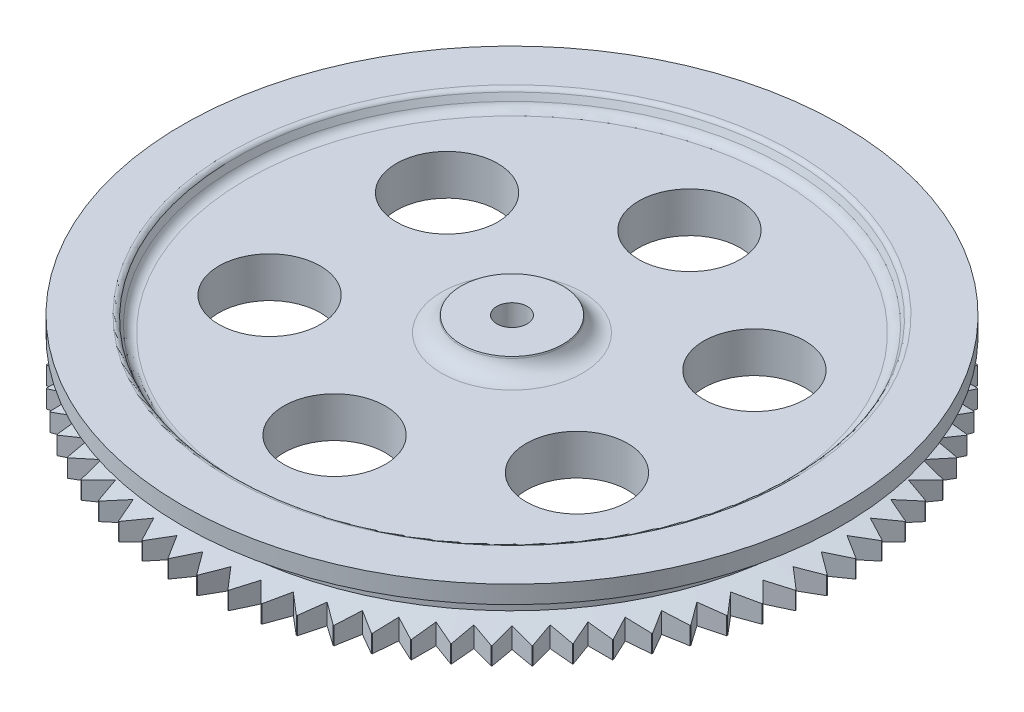
from build123d import *

# Parameters (mm, degrees)
SKETCH_2_R           = 3
CUT_EXTRUDE_1_DEPTH  = 93.983869569
CUT_EXTRUDE_2_DEPTH  = 5
CUT_EXTRUDE_6_DEPTH  = 5
CUT_EXTRUDE_7_DEPTH  = 5
CUT_EXTRUDE_8_DEPTH  = 5
CUT_EXTRUDE_9_DEPTH  = 5
CUT_EXTRUDE_10_DEPTH = 5
CUT_EXTRUDE_11_DEPTH = 5
SKETCH_5_R           = 10
CUT_EXTRUDE_12_DEPTH = 93.983869569
FILLET_1_R           = 2
FILLET_2_R           = 1
FILLET_3_R           = 4
FILLET_4_R           = 6
FILLET_5_R           = 3
FILLET_6_R           = 1


with BuildPart() as part:
    # Эскиз1 → Повернуть1 (revolve)
    with BuildSketch(Plane(origin=(0, 0, 0), x_dir=(0, 0, -1), z_dir=(1, 0, 0))):
        Polygon((0, 0), (0, 7), (-10, 7), (-11, 4), (-53.666009088, 4), (-55, 7), (-65, 7), (-65, 3.502957646), (-58, 2.5), (-58, 0), (-58, -2.5), (-65, -3.5), (-65, -7), (-55, -7), (-51.666666667, -4), (-20, -4), (-15, -7), (0, -7), align=None)
    revolve(axis=Axis((0, 0, 0), (0, -1, 0)))

    # Эскиз2 → Вырез-Вытянуть1 (cut, through all)
    with BuildSketch(Plane(origin=(0, 7, 0), x_dir=(1, 0, 0), z_dir=(0, 1, 0))):
        Circle(SKETCH_2_R)
    extrude(amount=-CUT_EXTRUDE_1_DEPTH, mode=Mode.SUBTRACT)

    # Эскиз3 → Вырез-Вытянуть2 (cut)
    with BuildSketch(Plane(origin=(0, -7, 0), x_dir=(-1, 0, 0), z_dir=(0, -1, 0))):
        Polygon((-6.5, 0), (-3.25, -5.629165125), (3.25, -5.629165125), (6.5, 0), (3.25, 5.629165125), (-3.25, 5.629165125), align=None)
    extrude(amount=-CUT_EXTRUDE_2_DEPTH, mode=Mode.SUBTRACT)

    # Эскиз4 → Вырез-Вытянуть6 (cut)
    with BuildSketch(Plane(origin=(0, -7, 0), x_dir=(-1, 0, 0), z_dir=(0, -1, 0))):
        with BuildLine():
            ThreePointArc((-13.994813839, -63.475547935), (-11.287131548, -64.012503946), (-8.559092709, -64.43401223))
            Line((-8.559092709, -64.43401223), (-10.592538838, -60.073272934))
            Line((-10.592538838, -60.073272934), (-13.994813839, -63.475547935))
        make_face()
        with BuildLine():
            Line((0, -61), (-2.759787945, -64.941385653))
            ThreePointArc((-2.759787945, -64.941385653), (0, -65), (2.759787945, -64.941385653))
            Line((2.759787945, -64.941385653), (0, -61))
        make_face()
        with BuildLine():
            ThreePointArc((-24.804614396, -60.081037813), (-22.231309316, -61.080020351), (-19.617909662, -61.96884395))
            Line((-19.617909662, -61.96884395), (-20.863228743, -57.321249868))
            Line((-20.863228743, -57.321249868), (-24.804614396, -60.081037813))
        make_face()
        with BuildLine():
            Line((10.592538838, -60.073272934), (8.559092709, -64.43401223))
            ThreePointArc((8.559092709, -64.43401223), (11.287131548, -64.012503946), (13.994813839, -63.475547935))
            Line((13.994813839, -63.475547935), (10.592538838, -60.073272934))
        make_face()
        with BuildLine():
            ThreePointArc((-34.860739296, -54.86099576), (-32.5, -56.291651246), (-30.080646357, -57.620783705))
            Line((-30.080646357, -57.620783705), (-30.5, -52.827549631))
            Line((-30.5, -52.827549631), (-34.860739296, -54.86099576))
        make_face()
        with BuildLine():
            Line((20.863228743, -57.321249868), (19.617909662, -61.96884395))
            ThreePointArc((19.617909662, -61.96884395), (22.231309316, -61.080020351), (24.804614396, -60.081037813))
            Line((24.804614396, -60.081037813), (20.863228743, -57.321249868))
        make_face()
        with BuildLine():
            ThreePointArc((-43.857638273, -47.974030111), (-41.78119463, -49.792888803), (-39.629397834, -51.521945104))
            Line((-39.629397834, -51.521945104), (-39.210044191, -46.72871103))
            Line((-39.210044191, -46.72871103), (-43.857638273, -47.974030111))
        make_face()
        with BuildLine():
            Line((30.5, -52.827549631), (30.080646357, -57.620783705))
            ThreePointArc((30.080646357, -57.620783705), (32.5, -56.291651246), (34.860739296, -54.86099576))
            Line((34.860739296, -54.86099576), (30.5, -52.827549631))
        make_face()
        with BuildLine():
            Line((39.210044191, -46.72871103), (39.629397834, -51.521945104))
            ThreePointArc((39.629397834, -51.521945104), (41.78119463, -49.792888803), (43.857638273, -47.974030111))
            Line((43.857638273, -47.974030111), (39.210044191, -46.72871103))
        make_face()
        with BuildLine():
            Line((46.72871103, -39.210044191), (47.974030111, -43.857638273))
            ThreePointArc((47.974030111, -43.857638273), (49.792888803, -41.78119463), (51.521945104, -39.629397834))
            Line((51.521945104, -39.629397834), (46.72871103, -39.210044191))
        make_face()
        with BuildLine():
            Line((52.827549631, -30.5), (54.86099576, -34.860739296))
            ThreePointArc((54.86099576, -34.860739296), (56.291651246, -32.5), (57.620783705, -30.080646357))
            Line((57.620783705, -30.080646357), (52.827549631, -30.5))
        make_face()
        with BuildLine():
            Line((57.321249868, -20.863228743), (60.081037813, -24.804614396))
            ThreePointArc((60.081037813, -24.804614396), (61.080020351, -22.231309316), (61.96884395, -19.617909662))
            Line((61.96884395, -19.617909662), (57.321249868, -20.863228743))
        make_face()
    extrude(amount=-CUT_EXTRUDE_6_DEPTH, mode=Mode.SUBTRACT)

    # Эскиз4<6> → Вырез-Вытянуть7 (cut)
    with BuildSketch(Plane(origin=(0, -7, 0), x_dir=(-1, 0, 0), z_dir=(0, -1, 0))):
        with BuildLine():
            Line((60.073272934, -10.592538838), (63.475547935, -13.994813839))
            ThreePointArc((63.475547935, -13.994813839), (64.012503946, -11.287131548), (64.43401223, -8.559092709))
            Line((64.43401223, -8.559092709), (60.073272934, -10.592538838))
        make_face()
        with BuildLine():
            Line((61, 0), (64.941385653, -2.759787945))
            ThreePointArc((64.941385653, -2.759787945), (65, 0), (64.941385653, 2.759787945))
            Line((64.941385653, 2.759787945), (61, 0))
        make_face()
        with BuildLine():
            Line((60.073272934, 10.592538838), (64.43401223, 8.559092709))
            ThreePointArc((64.43401223, 8.559092709), (64.012503946, 11.287131548), (63.475547935, 13.994813839))
            Line((63.475547935, 13.994813839), (60.073272934, 10.592538838))
        make_face()
        with BuildLine():
            Line((57.321249868, 20.863228743), (61.96884395, 19.617909662))
            ThreePointArc((61.96884395, 19.617909662), (61.080020351, 22.231309316), (60.081037813, 24.804614396))
            Line((60.081037813, 24.804614396), (57.321249868, 20.863228743))
        make_face()
        with BuildLine():
            Line((52.827549631, 30.5), (57.620783705, 30.080646357))
            ThreePointArc((57.620783705, 30.080646357), (56.291651246, 32.5), (54.86099576, 34.860739296))
            Line((54.86099576, 34.860739296), (52.827549631, 30.5))
        make_face()
        with BuildLine():
            Line((46.72871103, 39.210044191), (51.521945104, 39.629397834))
            ThreePointArc((51.521945104, 39.629397834), (49.792888803, 41.78119463), (47.974030111, 43.857638273))
            Line((47.974030111, 43.857638273), (46.72871103, 39.210044191))
        make_face()
        with BuildLine():
            Line((39.210044191, 46.72871103), (43.857638273, 47.974030111))
            ThreePointArc((43.857638273, 47.974030111), (41.78119463, 49.792888803), (39.629397834, 51.521945104))
            Line((39.629397834, 51.521945104), (39.210044191, 46.72871103))
        make_face()
        with BuildLine():
            Line((30.5, 52.827549631), (34.860739296, 54.86099576))
            ThreePointArc((34.860739296, 54.86099576), (32.5, 56.291651246), (30.080646357, 57.620783705))
            Line((30.080646357, 57.620783705), (30.5, 52.827549631))
        make_face()
        with BuildLine():
            ThreePointArc((-8.559092709, 64.43401223), (-11.287131548, 64.012503946), (-13.994813839, 63.475547935))
            Line((-13.994813839, 63.475547935), (-10.592538838, 60.073272934))
            Line((-10.592538838, 60.073272934), (-8.559092709, 64.43401223))
        make_face()
        with BuildLine():
            Line((20.863228743, 57.321249868), (24.804614396, 60.081037813))
            ThreePointArc((24.804614396, 60.081037813), (22.231309316, 61.080020351), (19.617909662, 61.96884395))
            Line((19.617909662, 61.96884395), (20.863228743, 57.321249868))
        make_face()
        with BuildLine():
            ThreePointArc((2.759787945, 64.941385653), (0, 65), (-2.759787945, 64.941385653))
            Line((-2.759787945, 64.941385653), (0, 61))
            Line((0, 61), (2.759787945, 64.941385653))
        make_face()
        with BuildLine():
            Line((10.592538838, 60.073272934), (13.994813839, 63.475547935))
            ThreePointArc((13.994813839, 63.475547935), (11.287131548, 64.012503946), (8.559092709, 64.43401223))
            Line((8.559092709, 64.43401223), (10.592538838, 60.073272934))
        make_face()
    extrude(amount=-CUT_EXTRUDE_7_DEPTH, mode=Mode.SUBTRACT)

    # Эскиз4<7> → Вырез-Вытянуть8 (cut)
    with BuildSketch(Plane(origin=(0, -7, 0), x_dir=(-1, 0, 0), z_dir=(0, -1, 0))):
        with BuildLine():
            ThreePointArc((-51.521945104, -39.629397834), (-49.792888803, -41.78119463), (-47.974030111, -43.857638273))
            Line((-47.974030111, -43.857638273), (-46.72871103, -39.210044191))
            Line((-46.72871103, -39.210044191), (-51.521945104, -39.629397834))
        make_face()
        with BuildLine():
            ThreePointArc((-57.620783705, -30.080646357), (-56.291651246, -32.5), (-54.86099576, -34.860739296))
            Line((-54.86099576, -34.860739296), (-52.827549631, -30.5))
            Line((-52.827549631, -30.5), (-57.620783705, -30.080646357))
        make_face()
        with BuildLine():
            ThreePointArc((-61.96884395, -19.617909662), (-61.080020351, -22.231309316), (-60.081037813, -24.804614396))
            Line((-60.081037813, -24.804614396), (-57.321249868, -20.863228743))
            Line((-57.321249868, -20.863228743), (-61.96884395, -19.617909662))
        make_face()
        with BuildLine():
            ThreePointArc((-64.43401223, -8.559092709), (-64.012503946, -11.287131548), (-63.475547935, -13.994813839))
            Line((-63.475547935, -13.994813839), (-60.073272934, -10.592538838))
            Line((-60.073272934, -10.592538838), (-64.43401223, -8.559092709))
        make_face()
        with BuildLine():
            ThreePointArc((-64.941385653, 2.759787945), (-65, 0), (-64.941385653, -2.759787945))
            Line((-64.941385653, -2.759787945), (-61, 0))
            Line((-61, 0), (-64.941385653, 2.759787945))
        make_face()
        with BuildLine():
            ThreePointArc((-63.475547935, 13.994813839), (-64.012503946, 11.287131548), (-64.43401223, 8.559092709))
            Line((-64.43401223, 8.559092709), (-60.073272934, 10.592538838))
            Line((-60.073272934, 10.592538838), (-63.475547935, 13.994813839))
        make_face()
        with BuildLine():
            ThreePointArc((-60.081037813, 24.804614396), (-61.080020351, 22.231309316), (-61.96884395, 19.617909662))
            Line((-61.96884395, 19.617909662), (-57.321249868, 20.863228743))
            Line((-57.321249868, 20.863228743), (-60.081037813, 24.804614396))
        make_face()
        with BuildLine():
            ThreePointArc((-54.86099576, 34.860739296), (-56.291651246, 32.5), (-57.620783705, 30.080646357))
            Line((-57.620783705, 30.080646357), (-52.827549631, 30.5))
            Line((-52.827549631, 30.5), (-54.86099576, 34.860739296))
        make_face()
        with BuildLine():
            ThreePointArc((-47.974030111, 43.857638273), (-49.792888803, 41.78119463), (-51.521945104, 39.629397834))
            Line((-51.521945104, 39.629397834), (-46.72871103, 39.210044191))
            Line((-46.72871103, 39.210044191), (-47.974030111, 43.857638273))
        make_face()
        with BuildLine():
            ThreePointArc((-39.629397834, 51.521945104), (-41.78119463, 49.792888803), (-43.857638273, 47.974030111))
            Line((-43.857638273, 47.974030111), (-39.210044191, 46.72871103))
            Line((-39.210044191, 46.72871103), (-39.629397834, 51.521945104))
        make_face()
        with BuildLine():
            ThreePointArc((-30.080646357, 57.620783705), (-32.5, 56.291651246), (-34.860739296, 54.86099576))
            Line((-34.860739296, 54.86099576), (-30.5, 52.827549631))
            Line((-30.5, 52.827549631), (-30.080646357, 57.620783705))
        make_face()
        with BuildLine():
            ThreePointArc((-19.617909662, 61.96884395), (-22.231309316, 61.080020351), (-24.804614396, 60.081037813))
            Line((-24.804614396, 60.081037813), (-20.863228743, 57.321249868))
            Line((-20.863228743, 57.321249868), (-19.617909662, 61.96884395))
        make_face()
    extrude(amount=-CUT_EXTRUDE_8_DEPTH, mode=Mode.SUBTRACT)

    # Эскиз4<8> → Вырез-Вытянуть9 (cut)
    with BuildSketch(Plane(origin=(0, -7, 0), x_dir=(-1, 0, 0), z_dir=(0, -1, 0))):
        with BuildLine():
            Line((-2.910728583, -64.934795442), (-5.316500308, -60.767876584))
            Line((-5.316500308, -60.767876584), (-8.40930082, -64.453732706))
            ThreePointArc((-8.40930082, -64.453732706), (-5.665123279, -64.752655376), (-2.910728583, -64.934795442))
        make_face()
        with BuildLine():
            Line((5.316500308, -60.767876584), (2.910728583, -64.934795442))
            ThreePointArc((2.910728583, -64.934795442), (5.665123279, -64.752655376), (8.40930082, -64.453732706))
            Line((8.40930082, -64.453732706), (5.316500308, -60.767876584))
        make_face()
        with BuildLine():
            Line((15.787961751, -58.921475404), (14.142316971, -63.442847278))
            ThreePointArc((14.142316971, -63.442847278), (16.823237932, -62.785178709), (19.473817873, -62.014275916))
            Line((19.473817873, -62.014275916), (15.787961751, -58.921475404))
        make_face()
        with BuildLine():
            Line((25.779713966, -55.284775009), (24.944198214, -60.023220302))
            ThreePointArc((24.944198214, -60.023220302), (27.470187013, -58.910006157), (29.946632825, -57.690546734))
            Line((29.946632825, -57.690546734), (25.779713966, -55.284775009))
        make_face()
        with BuildLine():
            Line((34.988162617, -49.968274702), (34.988162617, -54.779818151))
            ThreePointArc((34.988162617, -54.779818151), (37.282468363, -53.244882879), (39.509534491, -51.613919482))
            Line((39.509534491, -51.613919482), (34.988162617, -49.968274702))
        make_face()
        with BuildLine():
            Line((43.133513652, -43.133513652), (43.969029404, -47.871958945))
            ThreePointArc((43.969029404, -47.871958945), (45.961940777, -45.961940777), (47.871958945, -43.969029404))
            Line((47.871958945, -43.969029404), (43.133513652, -43.133513652))
        make_face()
        with BuildLine():
            Line((49.968274702, -34.988162617), (51.613919482, -39.509534491))
            ThreePointArc((51.613919482, -39.509534491), (53.244882879, -37.282468363), (54.779818151, -34.988162617))
            Line((54.779818151, -34.988162617), (49.968274702, -34.988162617))
        make_face()
        with BuildLine():
            Line((55.284775009, -25.779713966), (57.690546734, -29.946632825))
            ThreePointArc((57.690546734, -29.946632825), (58.910006157, -27.470187013), (60.023220302, -24.944198214))
            Line((60.023220302, -24.944198214), (55.284775009, -25.779713966))
        make_face()
        with BuildLine():
            Line((58.921475404, -15.787961751), (62.014275916, -19.473817873))
            ThreePointArc((62.014275916, -19.473817873), (62.785178709, -16.823237932), (63.442847278, -14.142316971))
            Line((63.442847278, -14.142316971), (58.921475404, -15.787961751))
        make_face()
        with BuildLine():
            Line((60.767876584, -5.316500308), (64.453732706, -8.40930082))
            ThreePointArc((64.453732706, -8.40930082), (64.752655376, -5.665123279), (64.934795442, -2.910728583))
            Line((64.934795442, -2.910728583), (60.767876584, -5.316500308))
        make_face()
        with BuildLine():
            Line((60.767876584, 5.316500308), (64.934795442, 2.910728583))
            ThreePointArc((64.934795442, 2.910728583), (64.752655376, 5.665123279), (64.453732706, 8.40930082))
            Line((64.453732706, 8.40930082), (60.767876584, 5.316500308))
        make_face()
        with BuildLine():
            Line((58.921475404, 15.787961751), (63.442847278, 14.142316971))
            ThreePointArc((63.442847278, 14.142316971), (62.785178709, 16.823237932), (62.014275916, 19.473817873))
            Line((62.014275916, 19.473817873), (58.921475404, 15.787961751))
        make_face()
    extrude(amount=-CUT_EXTRUDE_9_DEPTH, mode=Mode.SUBTRACT)

    # Эскиз4<9> → Вырез-Вытянуть10 (cut)
    with BuildSketch(Plane(origin=(0, -7, 0), x_dir=(-1, 0, 0), z_dir=(0, -1, 0))):
        with BuildLine():
            Line((55.284775009, 25.779713966), (60.023220302, 24.944198214))
            ThreePointArc((60.023220302, 24.944198214), (58.910006157, 27.470187013), (57.690546734, 29.946632825))
            Line((57.690546734, 29.946632825), (55.284775009, 25.779713966))
        make_face()
        with BuildLine():
            ThreePointArc((-43.969029404, 47.871958945), (-45.961940777, 45.961940777), (-47.871958945, 43.969029404))
            Line((-47.871958945, 43.969029404), (-43.133513652, 43.133513652))
            Line((-43.133513652, 43.133513652), (-43.969029404, 47.871958945))
        make_face()
        with BuildLine():
            Line((49.968274702, 34.988162617), (54.779818151, 34.988162617))
            ThreePointArc((54.779818151, 34.988162617), (53.244882879, 37.282468363), (51.613919482, 39.509534491))
            Line((51.613919482, 39.509534491), (49.968274702, 34.988162617))
        make_face()
        with BuildLine():
            ThreePointArc((-34.988162617, 54.779818151), (-37.282468363, 53.244882879), (-39.509534491, 51.613919482))
            Line((-39.509534491, 51.613919482), (-34.988162617, 49.968274702))
            Line((-34.988162617, 49.968274702), (-34.988162617, 54.779818151))
        make_face()
        with BuildLine():
            Line((43.133513652, 43.133513652), (47.871958945, 43.969029404))
            ThreePointArc((47.871958945, 43.969029404), (45.961940777, 45.961940777), (43.969029404, 47.871958945))
            Line((43.969029404, 47.871958945), (43.133513652, 43.133513652))
        make_face()
        with BuildLine():
            ThreePointArc((-24.944198214, 60.023220302), (-27.470187013, 58.910006157), (-29.946632825, 57.690546734))
            Line((-29.946632825, 57.690546734), (-25.779713966, 55.284775009))
            Line((-25.779713966, 55.284775009), (-24.944198214, 60.023220302))
        make_face()
        with BuildLine():
            Line((34.988162617, 49.968274702), (39.509534491, 51.613919482))
            ThreePointArc((39.509534491, 51.613919482), (37.282468363, 53.244882879), (34.988162617, 54.779818151))
            Line((34.988162617, 54.779818151), (34.988162617, 49.968274702))
        make_face()
        with BuildLine():
            ThreePointArc((-14.142316971, 63.442847278), (-16.823237932, 62.785178709), (-19.473817873, 62.014275916))
            Line((-19.473817873, 62.014275916), (-15.787961751, 58.921475404))
            Line((-15.787961751, 58.921475404), (-14.142316971, 63.442847278))
        make_face()
        with BuildLine():
            Line((25.779713966, 55.284775009), (29.946632825, 57.690546734))
            ThreePointArc((29.946632825, 57.690546734), (27.470187013, 58.910006157), (24.944198214, 60.023220302))
            Line((24.944198214, 60.023220302), (25.779713966, 55.284775009))
        make_face()
        with BuildLine():
            ThreePointArc((-2.910728583, 64.934795442), (-5.665123279, 64.752655376), (-8.40930082, 64.453732706))
            Line((-8.40930082, 64.453732706), (-5.316500308, 60.767876584))
            Line((-5.316500308, 60.767876584), (-2.910728583, 64.934795442))
        make_face()
        with BuildLine():
            Line((15.787961751, 58.921475404), (19.473817873, 62.014275916))
            ThreePointArc((19.473817873, 62.014275916), (16.823237932, 62.785178709), (14.142316971, 63.442847278))
            Line((14.142316971, 63.442847278), (15.787961751, 58.921475404))
        make_face()
        with BuildLine():
            ThreePointArc((8.40930082, 64.453732706), (5.665123279, 64.752655376), (2.910728583, 64.934795442))
            Line((2.910728583, 64.934795442), (5.316500308, 60.767876584))
            Line((5.316500308, 60.767876584), (8.40930082, 64.453732706))
        make_face()
    extrude(amount=-CUT_EXTRUDE_10_DEPTH, mode=Mode.SUBTRACT)

    # Эскиз4<10> → Вырез-Вытянуть11 (cut)
    with BuildSketch(Plane(origin=(0, -7, 0), x_dir=(-1, 0, 0), z_dir=(0, -1, 0))):
        with BuildLine():
            ThreePointArc((-19.473817873, -62.014275916), (-16.823237932, -62.785178709), (-14.142316971, -63.442847278))
            Line((-14.142316971, -63.442847278), (-15.787961751, -58.921475404))
            Line((-15.787961751, -58.921475404), (-19.473817873, -62.014275916))
        make_face()
        with BuildLine():
            ThreePointArc((-29.946632825, -57.690546734), (-27.470187013, -58.910006157), (-24.944198214, -60.023220302))
            Line((-24.944198214, -60.023220302), (-25.779713966, -55.284775009))
            Line((-25.779713966, -55.284775009), (-29.946632825, -57.690546734))
        make_face()
        with BuildLine():
            ThreePointArc((-39.509534491, -51.613919482), (-37.282468363, -53.244882879), (-34.988162617, -54.779818151))
            Line((-34.988162617, -54.779818151), (-34.988162617, -49.968274702))
            Line((-34.988162617, -49.968274702), (-39.509534491, -51.613919482))
        make_face()
        with BuildLine():
            ThreePointArc((-47.871958945, -43.969029404), (-45.961940777, -45.961940777), (-43.969029404, -47.871958945))
            Line((-43.969029404, -47.871958945), (-43.133513652, -43.133513652))
            Line((-43.133513652, -43.133513652), (-47.871958945, -43.969029404))
        make_face()
        with BuildLine():
            ThreePointArc((-54.779818151, -34.988162617), (-53.244882879, -37.282468363), (-51.613919482, -39.509534491))
            Line((-51.613919482, -39.509534491), (-49.968274702, -34.988162617))
            Line((-49.968274702, -34.988162617), (-54.779818151, -34.988162617))
        make_face()
        with BuildLine():
            ThreePointArc((-60.023220302, -24.944198214), (-58.910006157, -27.470187013), (-57.690546734, -29.946632825))
            Line((-57.690546734, -29.946632825), (-55.284775009, -25.779713966))
            Line((-55.284775009, -25.779713966), (-60.023220302, -24.944198214))
        make_face()
        with BuildLine():
            ThreePointArc((-63.442847278, -14.142316971), (-62.785178709, -16.823237932), (-62.014275916, -19.473817873))
            Line((-62.014275916, -19.473817873), (-58.921475404, -15.787961751))
            Line((-58.921475404, -15.787961751), (-63.442847278, -14.142316971))
        make_face()
        with BuildLine():
            ThreePointArc((-64.934795442, -2.910728583), (-64.752655376, -5.665123279), (-64.453732706, -8.40930082))
            Line((-64.453732706, -8.40930082), (-60.767876584, -5.316500308))
            Line((-60.767876584, -5.316500308), (-64.934795442, -2.910728583))
        make_face()
        with BuildLine():
            ThreePointArc((-64.453732706, 8.40930082), (-64.752655376, 5.665123279), (-64.934795442, 2.910728583))
            Line((-64.934795442, 2.910728583), (-60.767876584, 5.316500308))
            Line((-60.767876584, 5.316500308), (-64.453732706, 8.40930082))
        make_face()
        with BuildLine():
            ThreePointArc((-62.014275916, 19.473817873), (-62.785178709, 16.823237932), (-63.442847278, 14.142316971))
            Line((-63.442847278, 14.142316971), (-58.921475404, 15.787961751))
            Line((-58.921475404, 15.787961751), (-62.014275916, 19.473817873))
        make_face()
        with BuildLine():
            ThreePointArc((-57.690546734, 29.946632825), (-58.910006157, 27.470187013), (-60.023220302, 24.944198214))
            Line((-60.023220302, 24.944198214), (-55.284775009, 25.779713966))
            Line((-55.284775009, 25.779713966), (-57.690546734, 29.946632825))
        make_face()
        with BuildLine():
            ThreePointArc((-51.613919482, 39.509534491), (-53.244882879, 37.282468363), (-54.779818151, 34.988162617))
            Line((-54.779818151, 34.988162617), (-49.968274702, 34.988162617))
            Line((-49.968274702, 34.988162617), (-51.613919482, 39.509534491))
        make_face()
    extrude(amount=-CUT_EXTRUDE_11_DEPTH, mode=Mode.SUBTRACT)

    # Эскиз5 → Вырез-Вытянуть12 (cut, through all)
    with BuildSketch(Plane(origin=(0, -7, 0), x_dir=(-1, 0, 0), z_dir=(0, -1, 0))):
        with Locations((0, 35)):
            Circle(SKETCH_5_R)
        with Locations((30.310889132, 17.5)):
            Circle(SKETCH_5_R)
        with Locations((30.310889132, -17.5)):
            Circle(SKETCH_5_R)
        with Locations((0, -35)):
            Circle(SKETCH_5_R)
        with Locations((-30.310889132, -17.5)):
            Circle(SKETCH_5_R)
        with Locations((-30.310889132, 17.5)):
            Circle(SKETCH_5_R)
    extrude(amount=-CUT_EXTRUDE_12_DEPTH, mode=Mode.SUBTRACT)

    # Скругление1
    fillet_1_edges = [part.edges().sort_by_distance(p)[0] for p in [
        (0, 4, -53.666009088),
    ]]
    fillet(fillet_1_edges, radius=FILLET_1_R)

    # Скругление2
    fillet_2_edges = [part.edges().sort_by_distance(p)[0] for p in [
        (0, 7, -55),
    ]]
    fillet(fillet_2_edges, radius=FILLET_2_R)

    # Скругление3
    fillet_3_edges = [part.edges().sort_by_distance(p)[0] for p in [
        (0, 4, -11),
    ]]
    fillet(fillet_3_edges, radius=FILLET_3_R)

    # Скругление4
    fillet_4_edges = [part.edges().sort_by_distance(p)[0] for p in [
        (0, -4, -20),
    ]]
    fillet(fillet_4_edges, radius=FILLET_4_R)

    # Скругление5
    fillet_5_edges = [part.edges().sort_by_distance(p)[0] for p in [
        (0, -4, -51.666666667),
    ]]
    fillet(fillet_5_edges, radius=FILLET_5_R)

    # Скругление6
    fillet_6_edges = [part.edges().sort_by_distance(p)[0] for p in [
        (0, -7, -55),
    ]]
    fillet(fillet_6_edges, radius=FILLET_6_R)


solid = part.part
